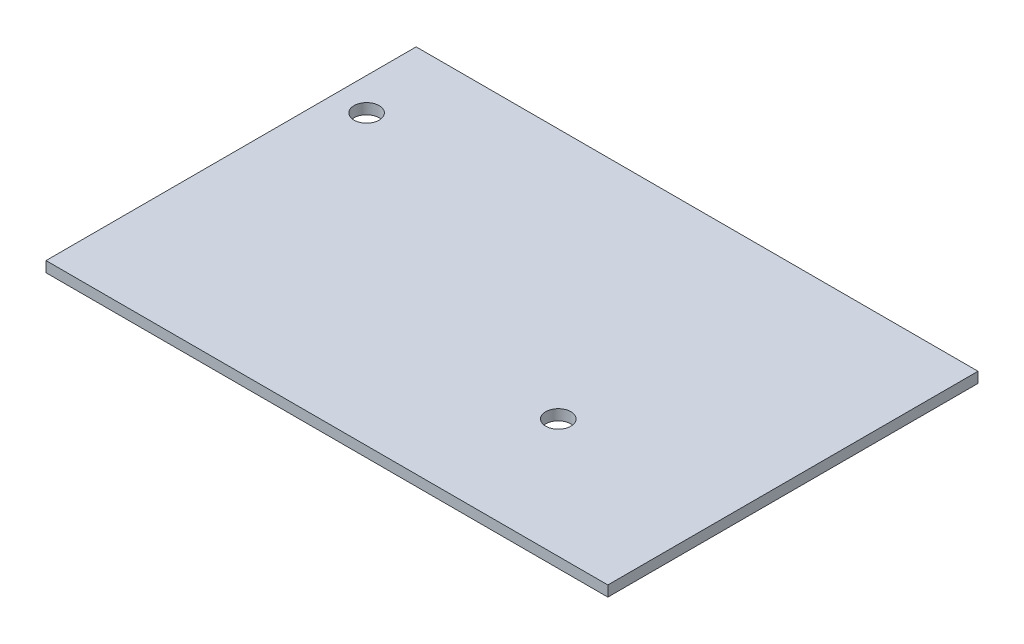
from build123d import *

# Parameters (mm, degrees)
SKETCH1_W        = 85
SKETCH1_H        = 56
SKETCH1_R        = 1.905
PRINTPLAAT_DEPTH = 1.6


with BuildPart() as part:
    # Sketch1 → Printplaat (new body)
    with BuildSketch(Plane(origin=(0, 0, 0), x_dir=(1, 0, 0), z_dir=(0, 1, 0))):
        with Locations((42.5, 28)):
            Rectangle(SKETCH1_W, SKETCH1_H)
        with Locations((59.5, 18)):
            Circle(SKETCH1_R, mode=Mode.SUBTRACT)
        with Locations((4.9, 43.6)):
            Circle(SKETCH1_R, mode=Mode.SUBTRACT)
    extrude(amount=PRINTPLAAT_DEPTH)


solid = part.part
